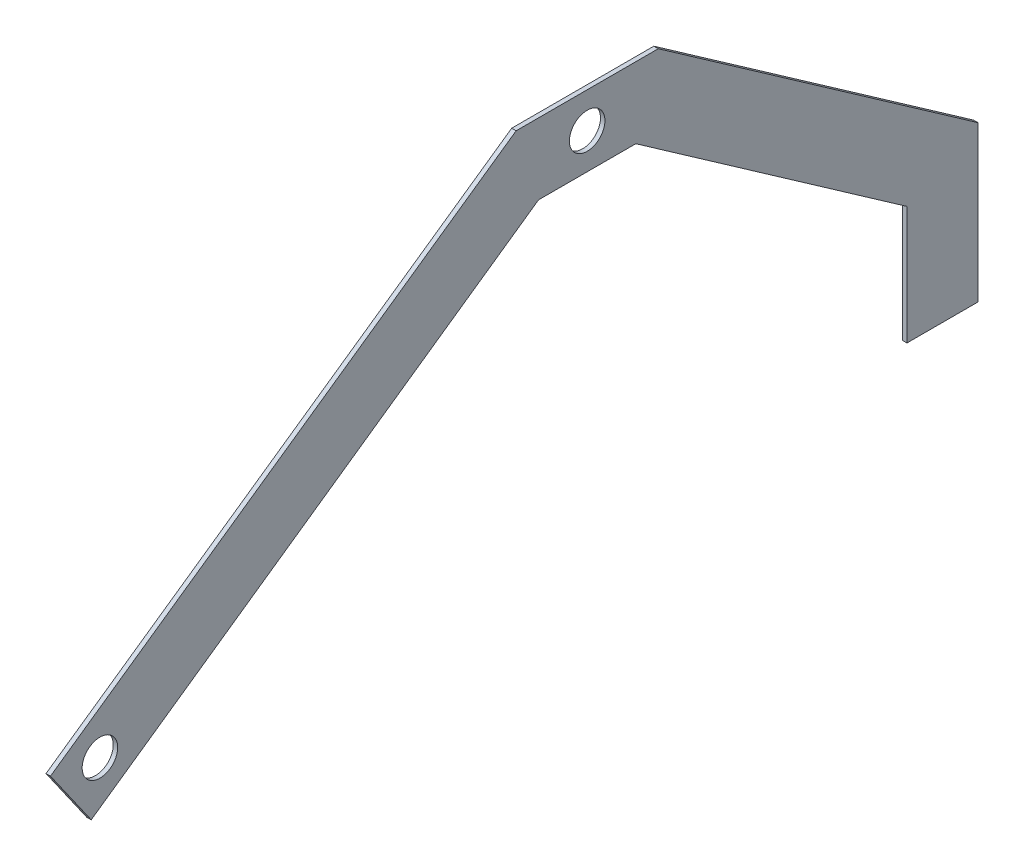
from build123d import *

# Parameters (mm, degrees)
SKETCH1_R           = 12.7
BOSS_EXTRUDE1_DEPTH = 3.175
SKETCH3_R           = 12.7
CUT_EXTRUDE2_DEPTH  = 625.997459763
SKETCH5_W           = 50.8
SKETCH5_H           = 247.65
CUT_EXTRUDE4_DEPTH  = 625.997459763


with BuildPart() as part:
    # Sketch1 → Boss-Extrude1 (new body)
    with BuildSketch(Plane(origin=(0, 0, 0), x_dir=(0, 0, -1), z_dir=(1, 0, 0))):
        Polygon((-50.8, 25.4), (50.8, 25.4), (279.4, -134.667443235), (279.4, -493.339084175), (228.6, -493.339084175), (228.6, -161.112249403), (34.782821525, -25.4), (-34.782821525, -25.4), (-354.565707832, -249.314387583), (-383.703390799, -207.701463733), align=None)
        with Locations((-348.328087391, -213.939084175)):
            Circle(SKETCH1_R, mode=Mode.SUBTRACT)
        Circle(SKETCH1_R, mode=Mode.SUBTRACT)
    extrude(amount=BOSS_EXTRUDE1_DEPTH)

    # Sketch3 → Cut-Extrude2 (cut, through all)
    with BuildSketch(Plane(origin=(3.175, 0, 0), x_dir=(0, 0, -1), z_dir=(1, 0, 0))):
        with Locations((254, -467.939084175)):
            Circle(SKETCH3_R)
    extrude(amount=-CUT_EXTRUDE2_DEPTH, mode=Mode.SUBTRACT)

    # Sketch5 → Cut-Extrude4 (cut, through all)
    with BuildSketch(Plane(origin=(3.175, 0, 0), x_dir=(0, 0, -1), z_dir=(1, 0, 0))):
        with Locations((254, -369.514084175)):
            Rectangle(SKETCH5_W, SKETCH5_H)
    extrude(amount=-CUT_EXTRUDE4_DEPTH, mode=Mode.SUBTRACT)


solid = part.part
